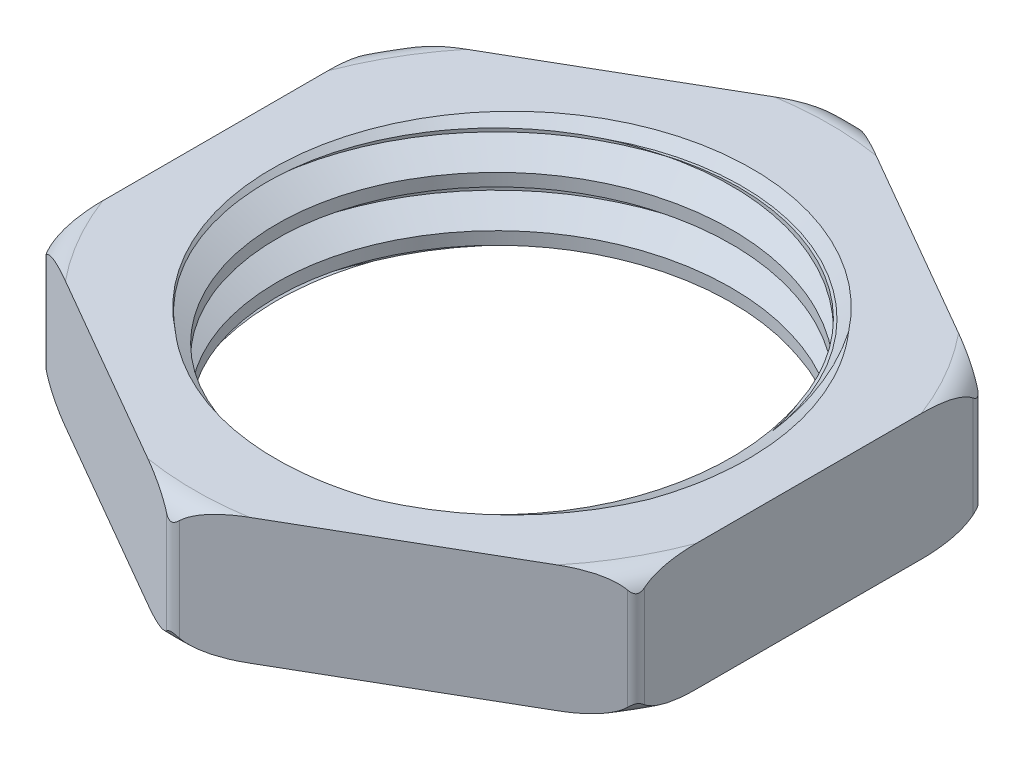
from build123d import *

# Parameters (mm, degrees)
SKETCH2_R               = 6.783865663
BOSS_EXTRUDE2_DEPTH     = 3.5
CUT_EXTRUDE2_REACH      = 12.212
SKETCH3_R               = 4.5
THREAD1_PITCH           = 1
CUT_EXTRUDE3_DEPTH      = 11.212329523
CUT_EXTRUDE3_DEPTH_BACK = 11.212329523
SKETCH8_W               = 13.567731326
SKETCH8_H               = 1
FILLET1_R               = 0.5
SKETCH1_OUTSIDE_W       = 19.438
SKETCH1_OUTSIDE_H       = 19.438
CUT_EXTRUDE1_DEPTH      = 2.5
FILLET2_R               = 0.25


with BuildPart() as part:
    # Sketch2 → Boss-Extrude2 (new body)
    with BuildSketch(Plane(origin=(0, 0, 0), x_dir=(1, 0, 0), z_dir=(0, 1, 0))):
        with Locations(Location((0, 0, 0), (0, 0, 270))):
            Circle(SKETCH2_R)
    extrude(amount=BOSS_EXTRUDE2_DEPTH)

    # Sketch3 → Cut-Extrude2 (cut, up to next)
    with BuildSketch(Plane(origin=(0, 0, 0), x_dir=(1, 0, 0), z_dir=(0, 1, 0)), mode=Mode.PRIVATE) as cut_extrude2_sk1:
        with Locations(Location((0, 0, 0), (0, 0, 90))):
            Circle(SKETCH3_R)
    cut_extrude2_tool1 = extrude(cut_extrude2_sk1.sketch, amount=CUT_EXTRUDE2_REACH, mode=Mode.PRIVATE) & part.part
    add(cut_extrude2_tool1.solids().sort_by_distance((0, 0, 0))[0], mode=Mode.SUBTRACT)

    # Thread1: the profile of Thread Profile2 profile screwed along a right-hand helix of 5 turns, 8 arcs to a turn; built about Z, then put on its axis
    thread1_z = Axis((0, 0, 0), (0, 0, 1))
    thread1_corners = [(4.4997, 0, -0.000173205), (5.041265875, 0, 0.312499999), (5.041265875, 0, 0.437499999), (4.4997, 0, 0.750173202)]
    with BuildLine(mode=Mode.PRIVATE) as thread1_profile:
        Line(thread1_corners[0], thread1_corners[1])
        Line(thread1_corners[1], thread1_corners[2])
        Line(thread1_corners[2], thread1_corners[3])
        Line(thread1_corners[3], thread1_corners[0])
    thread1_cap = Face(thread1_profile.wire())
    thread1_turn_angles = [0, 22.5, 45, 67.5, 90, 112.5, 135, 157.5, 180, 202.5, 225, 247.5, 270, 292.5, 315, 337.5, 360]
    thread1_turn_weights = [1, 0.9238795325112867, 1, 0.9238795325112867, 1, 0.9238795325112867, 1, 0.9238795325112867, 1, 0.9238795325112867, 1, 0.9238795325112867, 1, 0.9238795325112867, 1, 0.9238795325112867, 1]
    thread1_turn_rails = [Edge.make_bspline([Vector(p[0], p[1], 0).rotate(thread1_z, thread1_turn_angles[k]) / thread1_turn_weights[k] + Vector(0, 0, p[2] + THREAD1_PITCH * thread1_turn_angles[k] / 360) for k in range(17)], [0, 0, 0, 1, 1, 2, 2, 3, 3, 4, 4, 5, 5, 6, 6, 7, 7, 8, 8, 8], 2, thread1_turn_weights) for p in thread1_corners]
    thread1_turn_sides = [Face.make_surface_from_curves(thread1_turn_rails[p[0]], thread1_turn_rails[p[1]]) for p in [(0, 1), (1, 2), (2, 3), (3, 0)]]
    thread1 = Plane(origin=(0, 3.5, 0), x_dir=(-1, 0, 0), z_dir=(0, -1, 0)) * Solid(Shell([*[p.moved(Location((0, 0, THREAD1_PITCH * i))) for i in range(5) for p in thread1_turn_sides], thread1_cap, thread1_cap.rotate(thread1_z, 1800).moved(Location((0, 0, THREAD1_PITCH * 1800 / 360)))]))
    add(thread1, mode=Mode.SUBTRACT)

    # Sketch8 → Cut-Extrude3 (cut, two sides: drawn at the far end of the back side and taken through both)
    with BuildSketch(Plane.XY.offset(-CUT_EXTRUDE3_DEPTH_BACK)):
        with Locations((0, 3)):
            Rectangle(SKETCH8_W, SKETCH8_H)
    extrude(amount=CUT_EXTRUDE3_DEPTH + CUT_EXTRUDE3_DEPTH_BACK, mode=Mode.SUBTRACT)

    # Fillet1
    fillet1_edges = [part.edges().sort_by_distance(p)[0] for p in [
        (0, 0, -6.783865663),
        (0, 2.5, -6.783865663),
    ]]
    fillet(fillet1_edges, radius=FILLET1_R)

    # Sketch1 outside → Cut-Extrude1 (cut)
    with BuildSketch(Plane(origin=(0, 0, 0), x_dir=(1, 0, 0), z_dir=(0, 1, 0))):
        Rectangle(SKETCH1_OUTSIDE_W, SKETCH1_OUTSIDE_H)
        Polygon((0, 6.783865663), (-5.875, 3.391932831), (-5.875, -3.391932831), (0, -6.783865663), (5.875, -3.391932831), (5.875, 3.391932831), align=None, mode=Mode.SUBTRACT)
    extrude(amount=CUT_EXTRUDE1_DEPTH, mode=Mode.SUBTRACT)

    # Fillet2
    fillet2_edges = [part.edges().sort_by_distance(p)[0] for p in [
        (-5.875, 1.25, 3.391932831),
        (-5.875, 1.25, -3.391932831),
        (0, 1.25, -6.783865663),
        (5.875, 1.25, -3.391932831),
        (5.875, 1.25, 3.391932831),
        (0, 1.25, 6.783865663),
    ]]
    fillet(fillet2_edges, radius=FILLET2_R)

    # Sketch9 → Cut-Revolve1 (revolve, cut)
    with BuildSketch(Plane.XY):
        Polygon((-4.75, 2.5), (-4.55, 2.3), (0, 2.3), (0, 2.5), align=None)
        Polygon((0, 0), (-4.75, 0), (-4.55, 0.2), (0, 0.2), align=None)
    revolve(axis=Axis((0, 0, 0), (0, 1, 0)), mode=Mode.SUBTRACT)


solid = part.part
